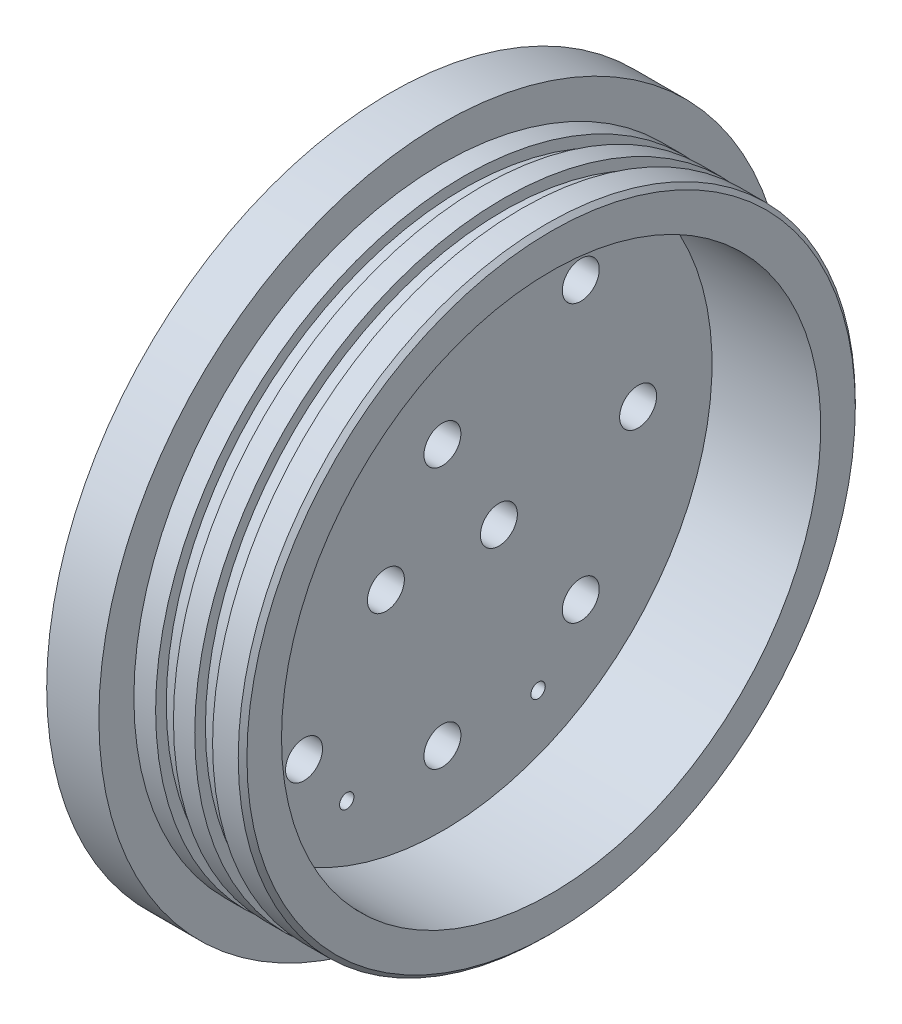
from build123d import *

# Parameters (mm, degrees)
CHAMFER_963_SIZE             = 1
SKETCH_2_W                   = 4.1
SKETCH_2_H                   = 2.45
PATTERN_LINEAR_O_2_COUNT     = 2
PATTERN_LINEAR_O_2_PITCH     = 9
PATTERN_CIRCULAR_M10_COUNT   = 8
PATTERN_CIRCULAR_M10_2_COUNT = 3


# Read off the part's stored shape, not the designer's step: トレイ支柱 M4（内側）
with BuildPart() as part:
    # ｽｹｯﾁ1 → Revolve 926 (revolve)
    with BuildSketch(Plane.XY, mode=Mode.PRIVATE) as revolve_926_sk:
        Polygon((-12, 0), (-12, 79), (0, 79), (0, 70.95), (25, 70.95), (25, 62), (0, 62), (0, 0), align=None)
    revolve(revolve_926_sk.sketch.rotate(Axis((0, 0, 0), (1, 0, 0)), 90), axis=Axis((0, 0, 0), (1, 0, 0)))

    # Chamfer 963
    chamfer_963_edges = [part.edges().sort_by_distance(p)[0] for p in [
        (25, 0, -70.95),
    ]]
    chamfer(chamfer_963_edges, length=CHAMFER_963_SIZE)

    # ｽｹｯﾁ2 → Oリング溝入れ G-135 (revolve, cut)
    with BuildSketch(Plane.XY, mode=Mode.PRIVATE) as o_g_135_sk:
        with Locations((7.05, 69.725)):
            Rectangle(SKETCH_2_W, SKETCH_2_H)
    o_g_135 = revolve(o_g_135_sk.sketch.rotate(Axis((0, 0, 0), (1, 0, 0)), 90), axis=Axis((0, 0, 0), (1, 0, 0)), mode=Mode.SUBTRACT)

    # Oリング溝 2 本目: Oリング溝入れ G-135 ×2
    with Locations(*[(i * PATTERN_LINEAR_O_2_PITCH, 0, 0) for i in range(1, PATTERN_LINEAR_O_2_COUNT)]):
        add(o_g_135, mode=Mode.SUBTRACT)

    # ｽｹｯﾁ3 → Hole Wizard M10 (revolve, cut)
    with BuildSketch(Plane(origin=(-12, 45, 0), x_dir=(0, 0, 1), z_dir=(0, 1, 0))):
        Polygon((0, 0), (0, 15.553657631), (4.25, 13), (4.25, 0), align=None)
    hole_wizard_m10 = revolve(axis=Axis((-18.35, 45, 0), (1, 0, 0)), mode=Mode.SUBTRACT)

    # Pattern Circular M10: Hole Wizard M10 ×8 about axis
    pattern_circular_m10_axis = Axis((0, 0, 0), (1, 0, 0))
    for i in range(1, PATTERN_CIRCULAR_M10_COUNT):
        add(hole_wizard_m10.rotate(pattern_circular_m10_axis, i * 360 / PATTERN_CIRCULAR_M10_COUNT), mode=Mode.SUBTRACT)

    # ｽｹｯﾁ5 → Hole Wizard M10 2 (revolve, cut)
    with BuildSketch(Plane(origin=(-12, 15, 0), x_dir=(0, 0, 1), z_dir=(0, 1, 0))):
        Polygon((0, 0), (0, 15.553657631), (4.25, 13), (4.25, 0), align=None)
    hole_wizard_m10_2 = revolve(axis=Axis((-18.35, 15, 0), (1, 0, 0)), mode=Mode.SUBTRACT)

    # Pattern Circular M10 2: Hole Wizard M10 2 ×3 about axis
    pattern_circular_m10_2_axis = Axis((0, 0, 0), (1, 0, 0))
    for i in range(1, PATTERN_CIRCULAR_M10_2_COUNT):
        add(hole_wizard_m10_2.rotate(pattern_circular_m10_2_axis, i * 360 / PATTERN_CIRCULAR_M10_2_COUNT), mode=Mode.SUBTRACT)

    # トレイ支柱 M4（内側） outline → トレイ支柱 M4（内側） (revolve, cut)
    with BuildSketch(Plane(origin=(0, -45, 22), x_dir=(0, 1, 0), z_dir=(0, 0, -1))):
        Polygon((0, 0), (0, -8.991420021), (1.65, -8), (1.65, 0), align=None)
    hole_wizard_m4 = revolve(axis=Axis((0, -45, 22), (1, 0, 0)), mode=Mode.SUBTRACT)

    # トレイ支柱 M4（内側・対称）: トレイ支柱 M4（内側） across plane
    add(hole_wizard_m4.mirror(Plane.XY), mode=Mode.SUBTRACT)


solid = part.part
